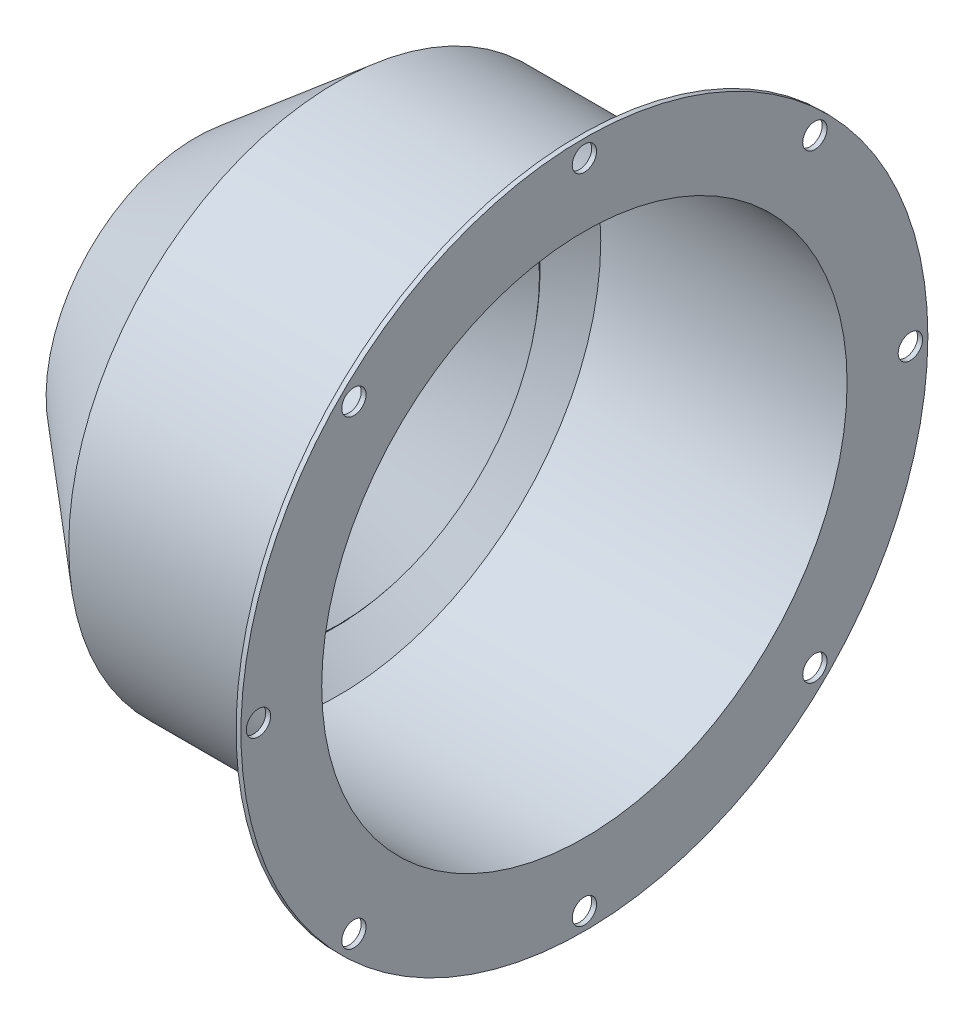
from build123d import *

# Parameters (mm, degrees)
SKETCH5_R           = 3.175
CUT_EXTRUDE1_DEPTH  = 2.54
BOSS_EXTRUDE1_DEPTH = 0.635
CIRPATTERN1_COUNT   = 4


with BuildPart() as part:
    # Sketch2 → Revolve1 (revolve)
    with BuildSketch(Plane(origin=(-56.392905866, 12.964436359, 6.379826334), x_dir=(1, 0, 0), z_dir=(0, 0, -1))):
        Polygon((8.1153, 89.662), (8.1153, 68.58), (-56.192457802, 68.58), (-92.517107305, 38.1), (-93.333447569, 39.072876443), (-56.6547, 69.85), (6.8453, 69.85), (6.8453, 89.662), align=None)
    revolve(axis=Axis((-15.062471046, 12.964436359, 6.379826334), (-1, 0, 0)))

    # Sketch5 → Cut-Extrude1 (cut)
    with BuildSketch(Plane.ZY.offset(49.547605866)):
        with Locations((6.379826334, 98.054436359)):
            Circle(SKETCH5_R)
        with Locations((66.547542345, 73.13215237)):
            Circle(SKETCH5_R)
        with Locations((91.469826334, 12.964436359)):
            Circle(SKETCH5_R)
        with Locations((66.547542345, -47.203279652)):
            Circle(SKETCH5_R)
        with Locations((6.379826334, -72.125563641)):
            Circle(SKETCH5_R)
        with Locations((-53.787889677, -47.203279652)):
            Circle(SKETCH5_R)
        with Locations((-78.710173666, 12.964436359)):
            Circle(SKETCH5_R)
        with Locations((-53.787889677, 73.13215237)):
            Circle(SKETCH5_R)
    extrude(amount=-CUT_EXTRUDE1_DEPTH, mode=Mode.SUBTRACT)



with BuildPart() as body_2:
    # Sketch4 → Revolve4 (revolve)
    with BuildSketch(Plane(origin=(88.374394134, 12.964436359, 6.379826334), x_dir=(1, 0, 0), z_dir=(0, 0, 1))):
        Polygon((-200.959757802, 52.578), (-263.265893439, 0.296944568), (-264.082233703, 1.26982101), (-201.776098067, 53.550876443), align=None)
    revolve(axis=Axis((-77.838260496, 12.964436359, 6.379826334), (-1, 0, 0)))


with BuildPart() as part_1:
    add(part.part)

    add(body_2.part)  # Boss-Extrude1 merges body 2
    # Sketch6 → Boss-Extrude1 (add, symmetric)
    with BuildSketch(Plane(origin=(88.374394134, 12.964436359, 6.379826334), x_dir=(1, 0, 0), z_dir=(0, 0, 1))):
        Polygon((-240.929921058, 35.219583178), (-233.080773337, 25.865333182), (-223.352008909, 34.028735825), (-231.20115663, 43.382985821), align=None)
    boss_extrude1 = extrude(amount=BOSS_EXTRUDE1_DEPTH, both=True)

    # CirPattern1: Boss-Extrude1 ×4 about axis
    cirpattern1_axis = Axis((-113.047605866, 12.964436359, 6.379826334), (-1, 0, 0))
    for i in range(1, CIRPATTERN1_COUNT):
        add(boss_extrude1.rotate(cirpattern1_axis, i * 360 / CIRPATTERN1_COUNT))


solid = part_1.part
